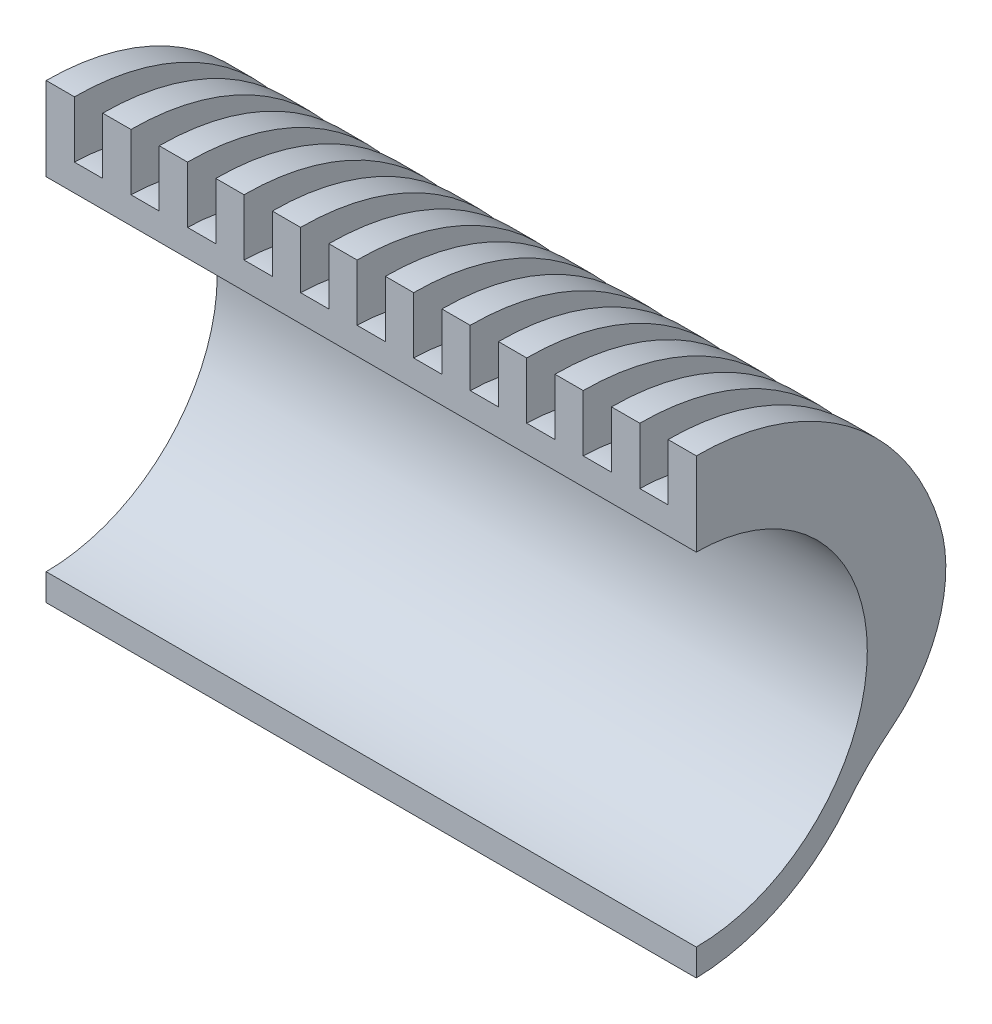
from build123d import *

# Parameters (mm, degrees)
SKETCH1_R           = 7
SKETCH1_R_2         = 0.8
SKETCH1_R_3         = 4
BOSS_EXTRUDE1_DEPTH = 1.5
SKETCH2_R           = 7
SKETCH2_R_2         = 6.4
BOSS_EXTRUDE2_DEPTH = 40.1
BOSS_EXTRUDE5_REACH = 44.786
SKETCH12_R          = 6.4
SKETCH12_R_2        = 6.05
BOSS_EXTRUDE7_START = -1
BOSS_EXTRUDE7_DEPTH = 1
FILLET2_R           = 10
FILLET3_R           = 5
LPATTERN1_START     = 18.6
LPATTERN1_DEPTH     = 1
LPATTERN1_START_2   = 20.6
LPATTERN1_2_DEPTH   = 1
LPATTERN1_START_3   = 22.6
LPATTERN1_3_DEPTH   = 1
LPATTERN1_START_4   = 24.6
LPATTERN1_4_DEPTH   = 1
LPATTERN1_START_5   = 26.6
LPATTERN1_5_DEPTH   = 1
LPATTERN1_START_6   = 28.6
LPATTERN1_6_DEPTH   = 1
LPATTERN1_START_7   = 30.6
LPATTERN1_7_DEPTH   = 1
LPATTERN1_START_8   = 32.6
LPATTERN1_8_DEPTH   = 1
LPATTERN1_START_9   = 34.6
LPATTERN1_9_DEPTH   = 1
LPATTERN1_START_10  = 36.6
LPATTERN1_10_DEPTH  = 1
LPATTERN1_START_11  = 38.6
LPATTERN1_11_DEPTH  = 1
SKETCH15_W          = 17.693531028
SKETCH15_H          = 16
SKETCH16_W          = 23
SKETCH16_H          = 16


with BuildPart() as part:
    # Sketch1 → Boss-Extrude1 (new body)
    with BuildSketch(Plane(origin=(0, 0, 0), x_dir=(0, 0, -1), z_dir=(1, 0, 0))):
        with Locations((-0.15, 0)):
            Circle(SKETCH1_R)
        with Locations((0, 5)):
            Circle(SKETCH1_R_2, mode=Mode.SUBTRACT)
        with Locations((-4.330127019, -2.5)):
            Circle(SKETCH1_R_2, mode=Mode.SUBTRACT)
        with Locations((4.330127019, -2.5)):
            Circle(SKETCH1_R_2, mode=Mode.SUBTRACT)
        Circle(SKETCH1_R_3, mode=Mode.SUBTRACT)
    extrude(amount=BOSS_EXTRUDE1_DEPTH)

    # Sketch2 → Boss-Extrude2 (add)
    with BuildSketch(Plane(origin=(1.5, 0, 0), x_dir=(0, 0, -1), z_dir=(1, 0, 0))):
        with Locations((-0.15, 0)):
            Circle(SKETCH2_R)
        with Locations((-0.15, 0)):
            Circle(SKETCH2_R_2, mode=Mode.SUBTRACT)
    extrude(amount=BOSS_EXTRUDE2_DEPTH)

    # Sketch12 → Boss-Extrude5 (add, up to next)
    with BuildSketch(Plane(origin=(41.6, 0, 0), x_dir=(0, 0, -1), z_dir=(1, 0, 0)), mode=Mode.PRIVATE) as boss_extrude5_sk1:
        with Locations((-0.15, 0)):
            Circle(SKETCH12_R)
        Circle(SKETCH12_R_2, mode=Mode.SUBTRACT)
    boss_extrude5_tool1 = extrude(boss_extrude5_sk1.sketch, amount=-BOSS_EXTRUDE5_REACH, mode=Mode.PRIVATE) - part.part
    add(boss_extrude5_tool1.solids().sort_by_distance((41.6, 0, 6.368981))[0])

    # Sketch14 → Boss-Extrude7 (add)
    with BuildSketch(Plane(origin=(41.6, 0, 0), x_dir=(0, 0, -1), z_dir=(1, 0, 0)).offset(BOSS_EXTRUDE7_START)):
        with BuildLine():
            Line((-7.039083492, -1.241180339), (-8.863269777, -1.562833599))
            ThreePointArc((-8.863269777, -1.562833599), (0, 9), (8.863269777, -1.562833599))
            Line((8.863269777, -1.562833599), (6.748129599, -1.189877318))
            ThreePointArc((6.748129599, -1.189877318), (-0.176047227, 6.999951539), (-7.039083492, -1.241180339))
        make_face()
    extrude(amount=BOSS_EXTRUDE7_DEPTH)

    # Fillet2
    # the kernel refuses this fillet: 10 mm, written as the material it adds along each edge
    with BuildSketch(Plane(origin=(40.6, -1.189877318, -6.748129599), x_dir=(0, -0.9122124275498226, 0.40971756982543417), z_dir=(1, 0, 0))) as fillet2_piece_1:
        with BuildLine():
            CenterArc((5.968676638, 9.685818843), FILLET2_R, 229.495547536, 26.104158306)
            Line((-0.526394739, 2.082263897), (-0.656296166, 1.930192799))
            ThreePointArc((-0.656296166, 1.930192799), (-0.457097485, 0.992114146), (-0.193900116, -0.049017803))
            Line((-0.193900116, -0.049017803), (0.049738972, -0.193716377))
            ThreePointArc((0.049738972, -0.193716377), (1.740864019, 0.01992681), (3.431989067, -0.193716377))
            Line((3.431989067, -0.193716377), (3.481728039, 0))
        make_face()
    extrude(amount=1)
    with BuildSketch(Plane(origin=(40.6, -1.241180339, 7.039083492), x_dir=(0, -0.9145376119425217, -0.4045008731047063), z_dir=(1, 0, 0))) as fillet2_piece_2:
        with BuildLine():
            CenterArc((5.662402917, -9.717692138), FILLET2_R, 103.646653122, 23.987142505)
            Line((-0.443720941, -1.798395993), (-0.565843418, -1.64001007))
            ThreePointArc((-0.565843418, -1.64001007), (-0.416037384, -0.851288435), (-0.194176914, 0.047909561))
            Line((-0.194176914, 0.047909561), (0.047186691, 0.194353843))
            ThreePointArc((0.047186691, 0.194353843), (1.651534184, 0.002384497), (3.255881677, 0.194353843))
            Line((3.255881677, 0.194353843), (3.303068368, 0))
        make_face()
    extrude(amount=1)

    # Fillet3
    fillet3_edges = [part.edges().sort_by_distance(p)[0] for p in [
        (41.1, -1.562833599, 8.863269777),
        (41.1, -1.562833599, -8.863269777),
    ]]
    fillet(fillet3_edges, radius=FILLET3_R)

    # LPattern1: read off the stored shape, not the designer's step
    # LPattern1 outline → LPattern1 (add)
    with BuildSketch(Plane.YZ.offset(LPATTERN1_START)):
        with BuildLine():
            ThreePointArc((-2.762069023, -6.931785952), (-0.336916962, -8.599750686), (2.606424088, -8.614322578))
            ThreePointArc((2.606424088, -8.614322578), (8.998759062, 0.149450112), (2.31893468, 8.696122236))
            ThreePointArc((2.31893468, 8.696122236), (-0.448823677, 8.641049813), (-2.763066821, 7.121905987))
            ThreePointArc((-2.763066821, 7.121905987), (-3.475808056, 6.373673153), (-4.261960597, 5.702989453))
            ThreePointArc((-4.261960597, 5.702989453), (6.999688602, 0.083973644), (-4.365952904, -5.321604449))
            ThreePointArc((-4.365952904, -5.321604449), (-3.518119256, -6.080982981), (-2.762069023, -6.931785952))
        make_face()
    extrude(amount=LPATTERN1_DEPTH)

    # LPattern1 2 outline → LPattern1 2 (add)
    with BuildSketch(Plane.YZ.offset(LPATTERN1_START_2)):
        with BuildLine():
            ThreePointArc((-2.762069023, -6.931785952), (-0.336916962, -8.599750686), (2.606424088, -8.614322578))
            ThreePointArc((2.606424088, -8.614322578), (8.998759062, 0.149450112), (2.31893468, 8.696122236))
            ThreePointArc((2.31893468, 8.696122236), (-0.448823677, 8.641049813), (-2.763066821, 7.121905987))
            ThreePointArc((-2.763066821, 7.121905987), (-3.475808056, 6.373673153), (-4.261960597, 5.702989453))
            ThreePointArc((-4.261960597, 5.702989453), (6.999688602, 0.083973644), (-4.365952904, -5.321604449))
            ThreePointArc((-4.365952904, -5.321604449), (-3.518119256, -6.080982981), (-2.762069023, -6.931785952))
        make_face()
    extrude(amount=LPATTERN1_2_DEPTH)

    # LPattern1 3 outline → LPattern1 3 (add)
    with BuildSketch(Plane.YZ.offset(LPATTERN1_START_3)):
        with BuildLine():
            ThreePointArc((-2.762069023, -6.931785952), (-0.336916962, -8.599750686), (2.606424088, -8.614322578))
            ThreePointArc((2.606424088, -8.614322578), (8.998759062, 0.149450112), (2.31893468, 8.696122236))
            ThreePointArc((2.31893468, 8.696122236), (-0.448823677, 8.641049813), (-2.763066821, 7.121905987))
            ThreePointArc((-2.763066821, 7.121905987), (-3.475808056, 6.373673153), (-4.261960597, 5.702989453))
            ThreePointArc((-4.261960597, 5.702989453), (6.999688602, 0.083973644), (-4.365952904, -5.321604449))
            ThreePointArc((-4.365952904, -5.321604449), (-3.518119256, -6.080982981), (-2.762069023, -6.931785952))
        make_face()
    extrude(amount=LPATTERN1_3_DEPTH)

    # LPattern1 4 outline → LPattern1 4 (add)
    with BuildSketch(Plane.YZ.offset(LPATTERN1_START_4)):
        with BuildLine():
            ThreePointArc((-2.762069023, -6.931785952), (-0.336916962, -8.599750686), (2.606424088, -8.614322578))
            ThreePointArc((2.606424088, -8.614322578), (8.998759062, 0.149450112), (2.31893468, 8.696122236))
            ThreePointArc((2.31893468, 8.696122236), (-0.448823677, 8.641049813), (-2.763066821, 7.121905987))
            ThreePointArc((-2.763066821, 7.121905987), (-3.475808056, 6.373673153), (-4.261960597, 5.702989453))
            ThreePointArc((-4.261960597, 5.702989453), (6.999688602, 0.083973644), (-4.365952904, -5.321604449))
            ThreePointArc((-4.365952904, -5.321604449), (-3.518119256, -6.080982981), (-2.762069023, -6.931785952))
        make_face()
    extrude(amount=LPATTERN1_4_DEPTH)

    # LPattern1 5 outline → LPattern1 5 (add)
    with BuildSketch(Plane.YZ.offset(LPATTERN1_START_5)):
        with BuildLine():
            ThreePointArc((-2.762069023, -6.931785952), (-0.336916962, -8.599750686), (2.606424088, -8.614322578))
            ThreePointArc((2.606424088, -8.614322578), (8.998759062, 0.149450112), (2.31893468, 8.696122236))
            ThreePointArc((2.31893468, 8.696122236), (-0.448823677, 8.641049813), (-2.763066821, 7.121905987))
            ThreePointArc((-2.763066821, 7.121905987), (-3.475808056, 6.373673153), (-4.261960597, 5.702989453))
            ThreePointArc((-4.261960597, 5.702989453), (6.999688602, 0.083973644), (-4.365952904, -5.321604449))
            ThreePointArc((-4.365952904, -5.321604449), (-3.518119256, -6.080982981), (-2.762069023, -6.931785952))
        make_face()
    extrude(amount=LPATTERN1_5_DEPTH)

    # LPattern1 6 outline → LPattern1 6 (add)
    with BuildSketch(Plane.YZ.offset(LPATTERN1_START_6)):
        with BuildLine():
            ThreePointArc((-2.762069023, -6.931785952), (-0.336916962, -8.599750686), (2.606424088, -8.614322578))
            ThreePointArc((2.606424088, -8.614322578), (8.998759062, 0.149450112), (2.31893468, 8.696122236))
            ThreePointArc((2.31893468, 8.696122236), (-0.448823677, 8.641049813), (-2.763066821, 7.121905987))
            ThreePointArc((-2.763066821, 7.121905987), (-3.475808056, 6.373673153), (-4.261960597, 5.702989453))
            ThreePointArc((-4.261960597, 5.702989453), (6.999688602, 0.083973644), (-4.365952904, -5.321604449))
            ThreePointArc((-4.365952904, -5.321604449), (-3.518119256, -6.080982981), (-2.762069023, -6.931785952))
        make_face()
    extrude(amount=LPATTERN1_6_DEPTH)

    # LPattern1 7 outline → LPattern1 7 (add)
    with BuildSketch(Plane.YZ.offset(LPATTERN1_START_7)):
        with BuildLine():
            ThreePointArc((-2.762069023, -6.931785952), (-0.336916962, -8.599750686), (2.606424088, -8.614322578))
            ThreePointArc((2.606424088, -8.614322578), (8.998759062, 0.149450112), (2.31893468, 8.696122236))
            ThreePointArc((2.31893468, 8.696122236), (-0.448823677, 8.641049813), (-2.763066821, 7.121905987))
            ThreePointArc((-2.763066821, 7.121905987), (-3.475808056, 6.373673153), (-4.261960597, 5.702989453))
            ThreePointArc((-4.261960597, 5.702989453), (6.999688602, 0.083973644), (-4.365952904, -5.321604449))
            ThreePointArc((-4.365952904, -5.321604449), (-3.518119256, -6.080982981), (-2.762069023, -6.931785952))
        make_face()
    extrude(amount=LPATTERN1_7_DEPTH)

    # LPattern1 8 outline → LPattern1 8 (add)
    with BuildSketch(Plane.YZ.offset(LPATTERN1_START_8)):
        with BuildLine():
            ThreePointArc((-2.762069023, -6.931785952), (-0.336916962, -8.599750686), (2.606424088, -8.614322578))
            ThreePointArc((2.606424088, -8.614322578), (8.998759062, 0.149450112), (2.31893468, 8.696122236))
            ThreePointArc((2.31893468, 8.696122236), (-0.448823677, 8.641049813), (-2.763066821, 7.121905987))
            ThreePointArc((-2.763066821, 7.121905987), (-3.475808056, 6.373673153), (-4.261960597, 5.702989453))
            ThreePointArc((-4.261960597, 5.702989453), (6.999688602, 0.083973644), (-4.365952904, -5.321604449))
            ThreePointArc((-4.365952904, -5.321604449), (-3.518119256, -6.080982981), (-2.762069023, -6.931785952))
        make_face()
    extrude(amount=LPATTERN1_8_DEPTH)

    # LPattern1 9 outline → LPattern1 9 (add)
    with BuildSketch(Plane.YZ.offset(LPATTERN1_START_9)):
        with BuildLine():
            ThreePointArc((-2.762069023, -6.931785952), (-0.336916962, -8.599750686), (2.606424088, -8.614322578))
            ThreePointArc((2.606424088, -8.614322578), (8.998759062, 0.149450112), (2.31893468, 8.696122236))
            ThreePointArc((2.31893468, 8.696122236), (-0.448823677, 8.641049813), (-2.763066821, 7.121905987))
            ThreePointArc((-2.763066821, 7.121905987), (-3.475808056, 6.373673153), (-4.261960597, 5.702989453))
            ThreePointArc((-4.261960597, 5.702989453), (6.999688602, 0.083973644), (-4.365952904, -5.321604449))
            ThreePointArc((-4.365952904, -5.321604449), (-3.518119256, -6.080982981), (-2.762069023, -6.931785952))
        make_face()
    extrude(amount=LPATTERN1_9_DEPTH)

    # LPattern1 10 outline → LPattern1 10 (add)
    with BuildSketch(Plane.YZ.offset(LPATTERN1_START_10)):
        with BuildLine():
            ThreePointArc((-2.762069023, -6.931785952), (-0.336916962, -8.599750686), (2.606424088, -8.614322578))
            ThreePointArc((2.606424088, -8.614322578), (8.998759062, 0.149450112), (2.31893468, 8.696122236))
            ThreePointArc((2.31893468, 8.696122236), (-0.448823677, 8.641049813), (-2.763066821, 7.121905987))
            ThreePointArc((-2.763066821, 7.121905987), (-3.475808056, 6.373673153), (-4.261960597, 5.702989453))
            ThreePointArc((-4.261960597, 5.702989453), (6.999688602, 0.083973644), (-4.365952904, -5.321604449))
            ThreePointArc((-4.365952904, -5.321604449), (-3.518119256, -6.080982981), (-2.762069023, -6.931785952))
        make_face()
    extrude(amount=LPATTERN1_10_DEPTH)

    # LPattern1 11 outline → LPattern1 11 (add)
    with BuildSketch(Plane.YZ.offset(LPATTERN1_START_11)):
        with BuildLine():
            ThreePointArc((-2.762069023, -6.931785952), (-0.336916962, -8.599750686), (2.606424088, -8.614322578))
            ThreePointArc((2.606424088, -8.614322578), (8.998759062, 0.149450112), (2.31893468, 8.696122236))
            ThreePointArc((2.31893468, 8.696122236), (-0.448823677, 8.641049813), (-2.763066821, 7.121905987))
            ThreePointArc((-2.763066821, 7.121905987), (-3.475808056, 6.373673153), (-4.261960597, 5.702989453))
            ThreePointArc((-4.261960597, 5.702989453), (6.999688602, 0.083973644), (-4.365952904, -5.321604449))
            ThreePointArc((-4.365952904, -5.321604449), (-3.518119256, -6.080982981), (-2.762069023, -6.931785952))
        make_face()
    extrude(amount=LPATTERN1_11_DEPTH)


with BuildPart() as body_2:
    # Split2: the piece behind the surface
    add(part.part)
    # Sketch15 → Surface-Plane1: a flat surface bounded by the sketch
    with BuildSketch(Plane.ZY.offset(-18.6), mode=Mode.PRIVATE) as surface_plane1_1_region:
        with Locations((0.018177702, 1)):
            Rectangle(SKETCH15_W, SKETCH15_H)
    surface_plane1_1 = surface_plane1_1_region.sketch.faces()[0]
    split(bisect_by=surface_plane1_1, keep=Keep.BOTTOM)


with BuildPart() as part_1:
    add(part.part)

    # Split2: split by a surface, the side it looks to stays
    # Sketch15 → Surface-Plane1: a flat surface bounded by the sketch
    with BuildSketch(Plane.ZY.offset(-18.6), mode=Mode.PRIVATE) as surface_plane1_2_region:
        with Locations((0.018177702, 1)):
            Rectangle(SKETCH15_W, SKETCH15_H)
    surface_plane1_2 = surface_plane1_2_region.sketch.faces()[0]
    split(bisect_by=surface_plane1_2, keep=Keep.TOP)


with BuildPart() as body_2_2:
    # Split3: the piece behind the surface
    add(body_2.part)
    # Sketch16 → Surface-Plane2: a flat surface bounded by the sketch
    with BuildSketch(Plane.XY, mode=Mode.PRIVATE) as surface_plane2_3_region:
        with Locations((30.1, 1)):
            Rectangle(SKETCH16_W, SKETCH16_H)
    surface_plane2_3 = surface_plane2_3_region.sketch.faces()[0]
    split(bisect_by=surface_plane2_3, keep=Keep.BOTTOM)


with BuildPart() as body_2_1:
    add(body_2.part)

    # Split3: split by a surface, the side it looks to stays
    # Sketch16 → Surface-Plane2: a flat surface bounded by the sketch
    with BuildSketch(Plane.XY, mode=Mode.PRIVATE) as surface_plane2_4_region:
        with Locations((30.1, 1)):
            Rectangle(SKETCH16_W, SKETCH16_H)
    surface_plane2_4 = surface_plane2_4_region.sketch.faces()[0]
    split(bisect_by=surface_plane2_4, keep=Keep.TOP)


solid = body_2_2.part
